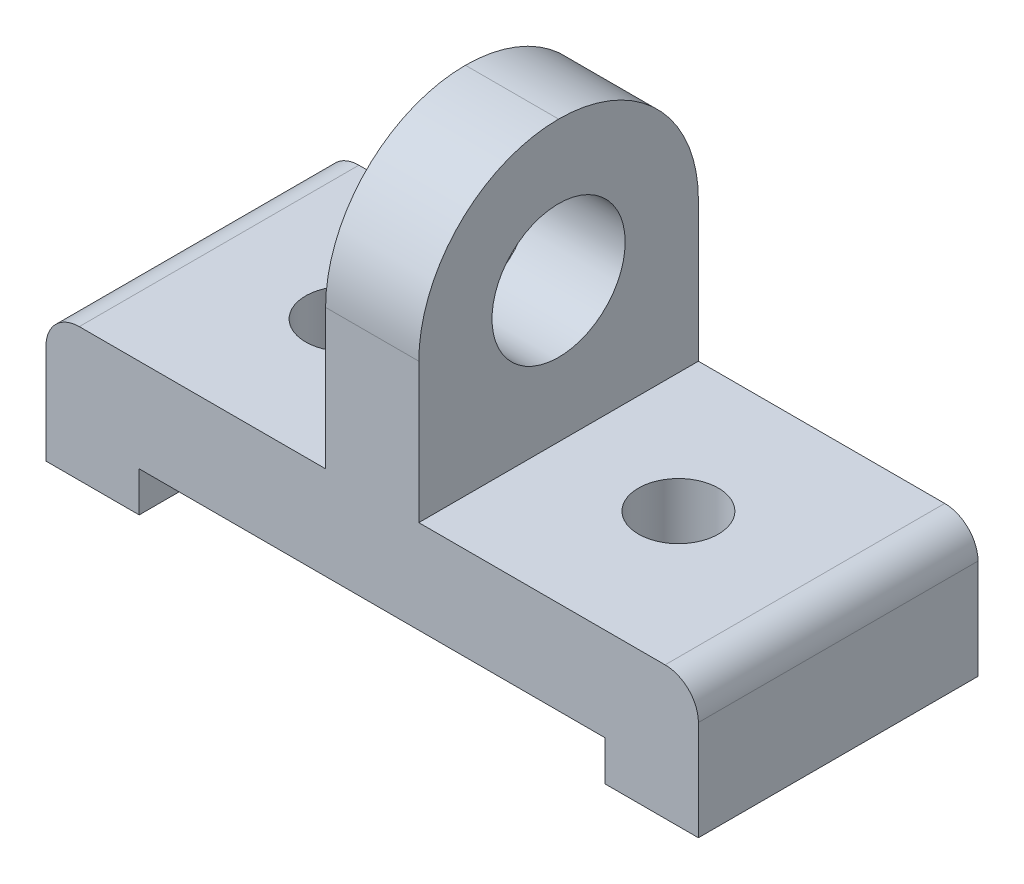
from build123d import *

# Parameters (mm, degrees)
BOSS_EXTRUDE1_DEPTH = 42
SKETCH4_R           = 6
CUT_EXTRUDE1_DEPTH  = 42
SKETCH6_W           = 14
SKETCH6_H           = 42
BOSS_EXTRUDE2_DEPTH = 42
FILLET1_R           = 21
SKETCH7_R           = 10
CUT_EXTRUDE2_DEPTH  = 42
FILLET4_R           = 5


with BuildPart() as part:
    # Sketch1 → Boss-Extrude1 (new body)
    with BuildSketch(Plane.XY):
        Polygon((0, 0), (-14, 0), (-14, 20), (84, 20), (84, 0), (70, 0), (70, 6), (0, 6), align=None)
    extrude(amount=-BOSS_EXTRUDE1_DEPTH)

    # Sketch4 → Cut-Extrude1 (cut)
    with BuildSketch(Plane(origin=(0, 20, 0), x_dir=(1, 0, 0), z_dir=(0, 1, 0))):
        with Locations(Location((60, 21, 0), (0, 0, 270))):
            Circle(SKETCH4_R)
        with Locations(Location((10, 21, 0), (0, 0, 270))):
            Circle(SKETCH4_R)
    extrude(amount=-CUT_EXTRUDE1_DEPTH, mode=Mode.SUBTRACT)

    # Sketch6 → Boss-Extrude2 (add)
    with BuildSketch(Plane(origin=(0, 20, 0), x_dir=(1, 0, 0), z_dir=(0, 1, 0))):
        with Locations((35, 21)):
            Rectangle(SKETCH6_W, SKETCH6_H)
    extrude(amount=BOSS_EXTRUDE2_DEPTH)

    # Fillet1
    fillet1_edges = [part.edges().sort_by_distance(p)[0] for p in [
        (35, 62, -42),
        (35, 62, 0),
    ]]
    fillet(fillet1_edges, radius=FILLET1_R - 0.0001)  # a hair under: the kernel refuses the full size

    # Sketch7 → Cut-Extrude2 (cut)
    with BuildSketch(Plane(origin=(42, 0, 0), x_dir=(0, 0, -1), z_dir=(1, 0, 0))):
        with Locations((21, 41)):
            Circle(SKETCH7_R)
    extrude(amount=-CUT_EXTRUDE2_DEPTH, mode=Mode.SUBTRACT)

    # Fillet4
    fillet4_edges = [part.edges().sort_by_distance(p)[0] for p in [
        (-14, 20, -21),
        (84, 20, -21),
    ]]
    fillet(fillet4_edges, radius=FILLET4_R)


solid = part.part
